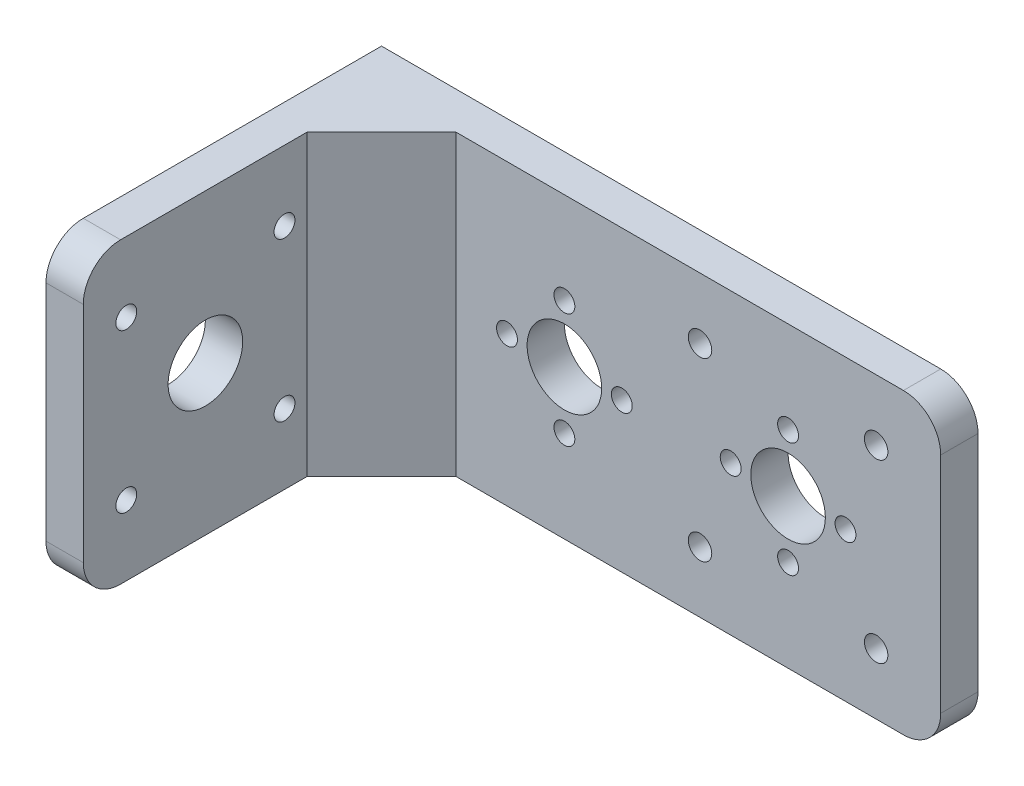
from build123d import *

# Parameters (mm, degrees)
SKETCH1_W                 = 101.6
SKETCH1_H                 = 50.8
BOSS_EXTRUDE1_DEPTH       = 6.35
SKETCH2_R                 = 2
CUT_EXTRUDE1_DEPTH        = 6.35
SKETCH3_R                 = 1.778
CUT_EXTRUDE2_DEPTH        = 6.35
SKETCH4_R                 = 6.35
CUT_EXTRUDE3_DEPTH        = 6.35
CIRPATTERN1_COUNT         = 4
SKETCH5_W                 = 6.35
SKETCH5_H                 = 50.8
BOSS_EXTRUDE2_DEPTH       = 50.8
SKETCH6_R                 = 6.35
CUT_EXTRUDE4_DEPTH        = 6.35
SKETCH7_R                 = 1.778
CUT_EXTRUDE5_DEPTH        = 6.35
CIRPATTERN2_COUNT         = 4
LPATTERN1_COUNT           = 2
LPATTERN1_PITCH           = 38.1
LPATTERN1_COPY_1_SKETCH_R = 1.778
LPATTERN1_COPY_1_DEPTH    = 6.35
LPATTERN1_COPY_2_SKETCH_R = 1.778
LPATTERN1_COPY_2_DEPTH    = 6.35
LPATTERN1_COPY_3_SKETCH_R = 1.778
LPATTERN1_COPY_3_DEPTH    = 6.35
LPATTERN1_COPY_4_SKETCH_R = 1.778
LPATTERN1_COPY_4_DEPTH    = 6.35
BOSS_EXTRUDE3_DEPTH       = 50.8
FILLET1_R                 = 6.35


with BuildPart() as part:
    # Sketch1 → Boss-Extrude1 (new body)
    with BuildSketch(Plane.XY):
        with Locations((-50.8, -25.4)):
            Rectangle(SKETCH1_W, SKETCH1_H)
    extrude(amount=BOSS_EXTRUDE1_DEPTH)

    # Sketch2 → Cut-Extrude1 (cut)
    with BuildSketch(Plane.XY.offset(6.35)):
        with Locations((-11, -10.400000028)):
            Circle(SKETCH2_R)
        with Locations((-41, -10.400000028)):
            Circle(SKETCH2_R)
        with Locations((-41, -40.399999972)):
            Circle(SKETCH2_R)
        with Locations((-11, -40.399999972)):
            Circle(SKETCH2_R)
    extrude(amount=-CUT_EXTRUDE1_DEPTH, mode=Mode.SUBTRACT)

    # Sketch3 → Cut-Extrude2 (cut)
    with BuildSketch(Plane.XY.offset(6.35)):
        with Locations((-26, -15.621)):
            Circle(SKETCH3_R)
    cut_extrude2 = extrude(amount=-CUT_EXTRUDE2_DEPTH, mode=Mode.SUBTRACT)

    # Sketch4 → Cut-Extrude3 (cut)
    with BuildSketch(Plane.XY.offset(6.35)):
        with Locations((-26, -25.4)):
            Circle(SKETCH4_R)
    cut_extrude3 = extrude(amount=-CUT_EXTRUDE3_DEPTH, mode=Mode.SUBTRACT)

    # CirPattern1: Cut-Extrude2 ×4 about axis
    cirpattern1_axis = Axis((-26, -25.4, 6.35), (0, 0, 1))
    for i in range(1, CIRPATTERN1_COUNT):
        add(cut_extrude2.rotate(cirpattern1_axis, i * 360 / CIRPATTERN1_COUNT), mode=Mode.SUBTRACT)

    # Sketch5 → Boss-Extrude2 (add)
    with BuildSketch(Plane.XY.offset(6.35)):
        with Locations((-98.425, -25.4)):
            Rectangle(SKETCH5_W, SKETCH5_H)
    extrude(amount=BOSS_EXTRUDE2_DEPTH)

    # Sketch6 → Cut-Extrude4 (cut)
    with BuildSketch(Plane(origin=(-95.25, 0, 0), x_dir=(0, 0, -1), z_dir=(1, 0, 0))):
        with Locations((-36.35, -25.4)):
            Circle(SKETCH6_R)
    extrude(amount=-CUT_EXTRUDE4_DEPTH, mode=Mode.SUBTRACT)

    # Sketch7 → Cut-Extrude5 (cut)
    with BuildSketch(Plane(origin=(-95.25, 0, 0), x_dir=(0, 0, -1), z_dir=(1, 0, 0))):
        with Locations((-49.8247, -11.9253)):
            Circle(SKETCH7_R)
    cut_extrude5 = extrude(amount=-CUT_EXTRUDE5_DEPTH, mode=Mode.SUBTRACT)

    # CirPattern2: Cut-Extrude5 ×4 about axis
    cirpattern2_axis = Axis((-95.25, -25.4, 36.35), (1, 0, 0))
    for i in range(1, CIRPATTERN2_COUNT):
        add(cut_extrude5.rotate(cirpattern2_axis, i * 360 / CIRPATTERN2_COUNT), mode=Mode.SUBTRACT)

    # LPattern1: Cut-Extrude3 ×2
    with Locations(*[(-i * LPATTERN1_PITCH, 0, 0) for i in range(1, LPATTERN1_COUNT)]):
        add(cut_extrude3, mode=Mode.SUBTRACT)

    # LPattern1 copy 1 sketch → LPattern1 copy 1 (cut)
    with BuildSketch(Plane(origin=(-89.5, 0.6, 6.35), x_dir=(0, 1, 0), z_dir=(0, 0, 1))):
        with Locations((-26, -15.621)):
            Circle(LPATTERN1_COPY_1_SKETCH_R)
    extrude(amount=-LPATTERN1_COPY_1_DEPTH, mode=Mode.SUBTRACT)

    # LPattern1 copy 2 sketch → LPattern1 copy 2 (cut)
    with BuildSketch(Plane(origin=(-90.1, -50.8, 6.35), x_dir=(-1, 0, 0), z_dir=(0, 0, 1))):
        with Locations((-26, -15.621)):
            Circle(LPATTERN1_COPY_2_SKETCH_R)
    extrude(amount=-LPATTERN1_COPY_2_DEPTH, mode=Mode.SUBTRACT)

    # LPattern1 copy 3 sketch → LPattern1 copy 3 (cut)
    with BuildSketch(Plane(origin=(-38.7, -51.4, 6.35), x_dir=(0, -1, 0), z_dir=(0, 0, 1))):
        with Locations((-26, -15.621)):
            Circle(LPATTERN1_COPY_3_SKETCH_R)
    extrude(amount=-LPATTERN1_COPY_3_DEPTH, mode=Mode.SUBTRACT)

    # LPattern1 copy 4 sketch → LPattern1 copy 4 (cut)
    with BuildSketch(Plane(origin=(-38.1, 0, 6.35), x_dir=(1, 0, 0), z_dir=(0, 0, 1))):
        with Locations((-26, -15.621)):
            Circle(LPATTERN1_COPY_4_SKETCH_R)
    extrude(amount=-LPATTERN1_COPY_4_DEPTH, mode=Mode.SUBTRACT)

    # Sketch8 → Boss-Extrude3 (add)
    with BuildSketch(Plane.XZ.offset(50.8)):
        Polygon((-95.25, 6.35), (-95.25, 19.05), (-82.55, 6.35), align=None)
    extrude(amount=-BOSS_EXTRUDE3_DEPTH)

    # Fillet1
    fillet1_edges = [part.edges().sort_by_distance(p)[0] for p in [
        (0, -50.8, 3.175),
        (0, 0, 3.175),
        (-98.425, 0, 57.15),
        (-98.425, -50.8, 57.15),
    ]]
    fillet(fillet1_edges, radius=FILLET1_R)


solid = part.part
